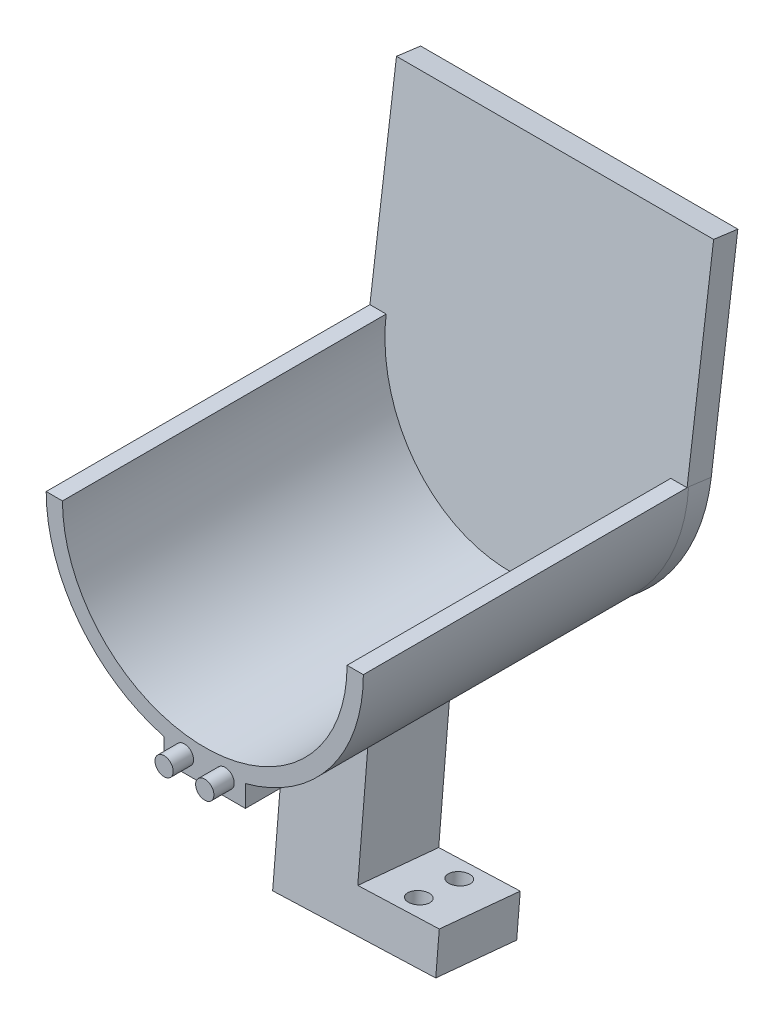
from build123d import *

# Parameters (mm, degrees)
EXTRUDE_THIN1_DEPTH       = 80
BOSS_EXTRUDE1_START       = -10
BOSS_EXTRUDE1_DEPTH       = 10
SKETCH3_R                 = 2.25
BOSS_EXTRUDE2_DEPTH       = 5
BOSS_EXTRUDE3_DEPTH       = 10
SKETCH5_R                 = 2.25
CUT_EXTRUDE1_DEPTH        = 6
BOSS_EXTRUDE4_REACH       = 104.415
BOSS_EXTRUDE4_END_RADIUS  = 39
SKETCH10_W                = 20
SKETCH10_H                = 20
BOSS_EXTRUDE6_DEPTH       = 6
BOSS_EXTRUDE7_START       = -38.548677333
BOSS_EXTRUDE7_OUTLINE_W   = 20
BOSS_EXTRUDE7_OUTLINE_H   = 20
BOSS_EXTRUDE7_DEPTH       = 38.548677333
BOSS_EXTRUDE7_START_2     = 88.145703723
BOSS_EXTRUDE7_2_OUTLINE_W = 23
BOSS_EXTRUDE7_2_OUTLINE_H = 23
BOSS_EXTRUDE7_2_DEPTH     = 1.854296277
BOSS_EXTRUDE9_DEPTH       = 20
SKETCH16_R                = 2.5
CUT_EXTRUDE2_DEPTH        = 20


with BuildPart() as part:
    # Sketch1 → Extrude-Thin1 (new body)
    with BuildSketch(Plane.XY):
        with BuildLine():
            ThreePointArc((-35, 0), (0, -35), (35, 0))
            Line((35, 0), (39, 0))
            ThreePointArc((39, 0), (0, -39), (-39, 0))
            Line((-39, 0), (-35, 0))
        make_face()
    extrude(amount=EXTRUDE_THIN1_DEPTH)

    # Sketch2 → Boss-Extrude1 (add)
    with BuildSketch(Plane.XY.offset(80).offset(BOSS_EXTRUDE1_START)):
        with BuildLine():
            Line((0, -39), (0, -35))
            Line((0, -35), (-10, -35))
            Line((-10, -35), (-10, -37.69615365))
            ThreePointArc((-10, -37.69615365), (-5.042321274, -38.672664715), (0, -39))
        make_face()
        with BuildLine():
            Line((10, -35), (0, -35))
            Line((0, -35), (0, -39))
            ThreePointArc((0, -39), (5.042321274, -38.672664715), (10, -37.69615365))
            Line((10, -37.69615365), (10, -35))
        make_face()
        with BuildLine():
            ThreePointArc((10, -37.69615365), (5.042321274, -38.672664715), (0, -39))
            ThreePointArc((0, -39), (-5.042321274, -38.672664715), (-10, -37.69615365))
            Line((-10, -37.69615365), (-10, -43))
            Line((-10, -43), (10, -43))
            Line((10, -43), (10, -37.69615365))
        make_face()
    extrude(amount=BOSS_EXTRUDE1_DEPTH)

    # Sketch3 → Boss-Extrude2 (add)
    with BuildSketch(Plane.XY.offset(80)):
        with Locations((-5, -39)):
            Circle(SKETCH3_R)
        with Locations((5, -39)):
            Circle(SKETCH3_R)
    extrude(amount=BOSS_EXTRUDE2_DEPTH)

    # Sketch4 → Boss-Extrude3 (add)
    with BuildSketch(Plane(origin=(0, 0, 0), x_dir=(-1, 0, 0), z_dir=(0, 0, -1))):
        with BuildLine():
            Line((0, -39), (0, -35))
            Line((0, -35), (-10, -35))
            Line((-10, -35), (-10, -37.69615365))
            ThreePointArc((-10, -37.69615365), (-5.042321274, -38.672664715), (0, -39))
        make_face()
        with BuildLine():
            ThreePointArc((10, -37.69615365), (5.042321274, -38.672664715), (0, -39))
            ThreePointArc((0, -39), (-5.042321274, -38.672664715), (-10, -37.69615365))
            Line((-10, -37.69615365), (-10, -43))
            Line((-10, -43), (10, -43))
            Line((10, -43), (10, -37.69615365))
        make_face()
        with BuildLine():
            Line((10, -35), (0, -35))
            Line((0, -35), (0, -39))
            ThreePointArc((0, -39), (5.042321274, -38.672664715), (10, -37.69615365))
            Line((10, -37.69615365), (10, -35))
        make_face()
    extrude(amount=-BOSS_EXTRUDE3_DEPTH)

    # Sketch5 → Cut-Extrude1 (cut)
    with BuildSketch(Plane(origin=(0, 0, 0), x_dir=(-1, 0, 0), z_dir=(0, 0, -1))):
        with Locations(Location((-5, -39, 0), (0, 0, 180))):
            Circle(SKETCH5_R)
        with Locations(Location((5, -39, 0), (0, 0, 180))):
            Circle(SKETCH5_R)
    extrude(amount=-CUT_EXTRUDE1_DEPTH, mode=Mode.SUBTRACT)

    # Boss-Extrude4: up to this cylinder (the profile starts outside it)
    boss_extrude4_end = Plane(origin=(0, 0, 40), z_dir=(0, 0, -1)) * Cylinder(BOSS_EXTRUDE4_END_RADIUS, 287.83, mode=Mode.PRIVATE)
    # Sketch10 → Boss-Extrude4 (add, up to the surface)
    with BuildSketch(Plane(origin=(0, -49.619293796, 4.341125699), x_dir=(1, 0, 0), z_dir=(0, 0.9961946980917462, -0.08715574274765152)), mode=Mode.PRIVATE) as boss_extrude4_sk1:
        with Locations((0, -35.795085407)):
            Rectangle(SKETCH10_W, SKETCH10_H)
    boss_extrude4_tool1 = extrude(boss_extrude4_sk1.sketch, amount=BOSS_EXTRUDE4_REACH, mode=Mode.PRIVATE) - boss_extrude4_end
    add(boss_extrude4_tool1.solids().sort_by_distance((0, -46.499547, 40))[0])

    # Sketch14 → Boss-Extrude6 (add)
    with BuildSketch(Plane(origin=(0, -0.732594735, -5.56460947), x_dir=(1, 0, 0), z_dir=(0, 0.130526192220045, 0.9914448613738114))):
        with BuildLine():
            Line((-39, 0), (-39, 50))
            Line((-39, 50), (39, 50))
            Line((39, 50), (39, 0))
            ThreePointArc((39, 0), (0, -39), (-39, 0))
        make_face()
    extrude(amount=BOSS_EXTRUDE6_DEPTH)

    # Boss-Extrude7: read off the stored shape, not the designer's step
    # Boss-Extrude7 outline → Boss-Extrude7 (add)
    with BuildSketch(Plane(origin=(0, -49.619293796, 4.341125699), x_dir=(1, 0, 0), z_dir=(0, 0.9961946980917462, -0.08715574274765152)).offset(BOSS_EXTRUDE7_START)):
        with Locations((0, -35.795085407)):
            Rectangle(BOSS_EXTRUDE7_OUTLINE_W, BOSS_EXTRUDE7_OUTLINE_H)
    extrude(amount=BOSS_EXTRUDE7_DEPTH)

    # Boss-Extrude7 2 outline → Boss-Extrude7 2 (cut)
    with BuildSketch(Plane(origin=(0, 0, 0), x_dir=(0.9994119135527714, 0.03413748045727771, -0.003234111441613329), z_dir=(0.0342903346263607, -0.9949568891477218, 0.09426007473315608)).offset(BOSS_EXTRUDE7_START_2)):
        with Locations((-3.5, 35.5)):
            Rectangle(BOSS_EXTRUDE7_2_OUTLINE_W, BOSS_EXTRUDE7_2_OUTLINE_H)
    extrude(amount=BOSS_EXTRUDE7_2_DEPTH, mode=Mode.SUBTRACT)

    # Sketch15 → Boss-Extrude9 (add, along a direction that is not the sketch's normal)
    with BuildSketch(Plane(origin=(10, 0, 0), x_dir=(0, 0, -1), z_dir=(1, 0, 0))):
        Polygon((-53.249344589, -83.203115712), (-33.337982915, -85.089475272), (-32.46309628, -75.089475272), (-52.374457954, -73.203115712), align=None)
    extrude(amount=BOSS_EXTRUDE9_DEPTH, dir=(0.9994118831812419, 0.034160731366783506, -0.0029886767323038838))

    # Sketch16 → Cut-Extrude2 (cut)
    with BuildSketch(Plane(origin=(2.678543813, -77.719732066, 7.363000179), x_dir=(0.9994101830326216, 0.03396190638807467, -0.005086744065644862), z_dir=(-0.03429033462636075, 0.9949568891477218, -0.0942600747331567))):
        with Locations(Location((17.250851161, -40.271437351, 0), (0, 0, 269.893376297))):
            Circle(SKETCH16_R)
        with Locations(Location((17.269461459, -30.270938076, 0), (0, 0, 269.893376297))):
            Circle(SKETCH16_R)
    extrude(amount=-CUT_EXTRUDE2_DEPTH, mode=Mode.SUBTRACT)


solid = part.part
